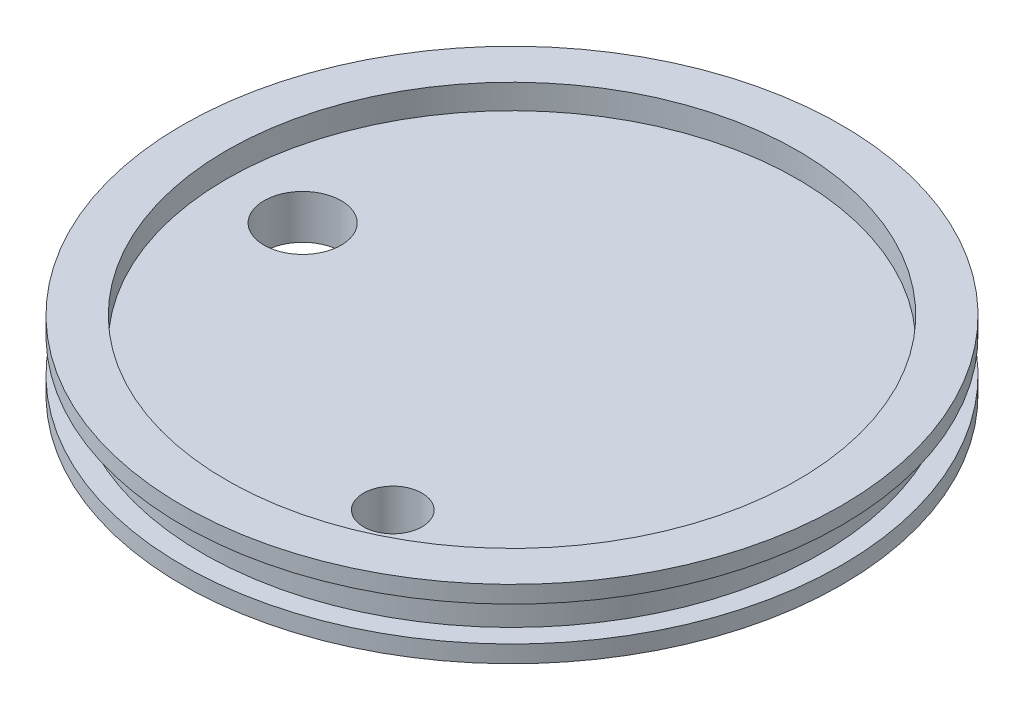
from build123d import *

# Parameters (mm, degrees)
PIPE_TAP_DRILL_FOR_1_4_TAP1_D = 11.1252
PIPE_TAP_DRILL_FOR_1_8_TAP1_D = 8.4328
SKETCH6_R                     = 6.35
BOSS_EXTRUDE1_DEPTH           = 6.35


with BuildPart() as part:
    # Sketch1 → Revolve1 (revolve)
    with BuildSketch(Plane.XY):
        Polygon((0, 0), (47.498, 0), (47.498, 2.4638), (44.577, 2.4638), (44.577, 7.4422), (47.498, 7.4422), (47.498, 9.906), (41.148, 9.906), (41.148, 6.35), (0, 6.35), align=None)
    revolve(axis=Axis((0, 48.192213231, 0), (0, -1, 0)))

    # Pipe Tap Drill for 1/4 Tap1 (through all)
    with Locations(Plane(origin=(0, 6.35, 0), x_dir=(1, 0, 0), z_dir=(0, 1, 0))):
        with Locations((0, 0), (-30.1752, 0)):
            Hole(PIPE_TAP_DRILL_FOR_1_4_TAP1_D / 2)

    # Pipe Tap Drill for 1/8 Tap1 (through all)
    with Locations(Plane(origin=(0, 6.35, 0), x_dir=(1, 0, 0), z_dir=(0, 1, 0))):
        with Locations((12.150198978, -29.333175157)):
            Hole(PIPE_TAP_DRILL_FOR_1_8_TAP1_D / 2)

    # Sketch6 → Boss-Extrude1 (add)
    with BuildSketch(Plane(origin=(0, 6.35, 0), x_dir=(1, 0, 0), z_dir=(0, 1, 0))):
        Circle(SKETCH6_R)
    extrude(amount=-BOSS_EXTRUDE1_DEPTH)


solid = part.part
